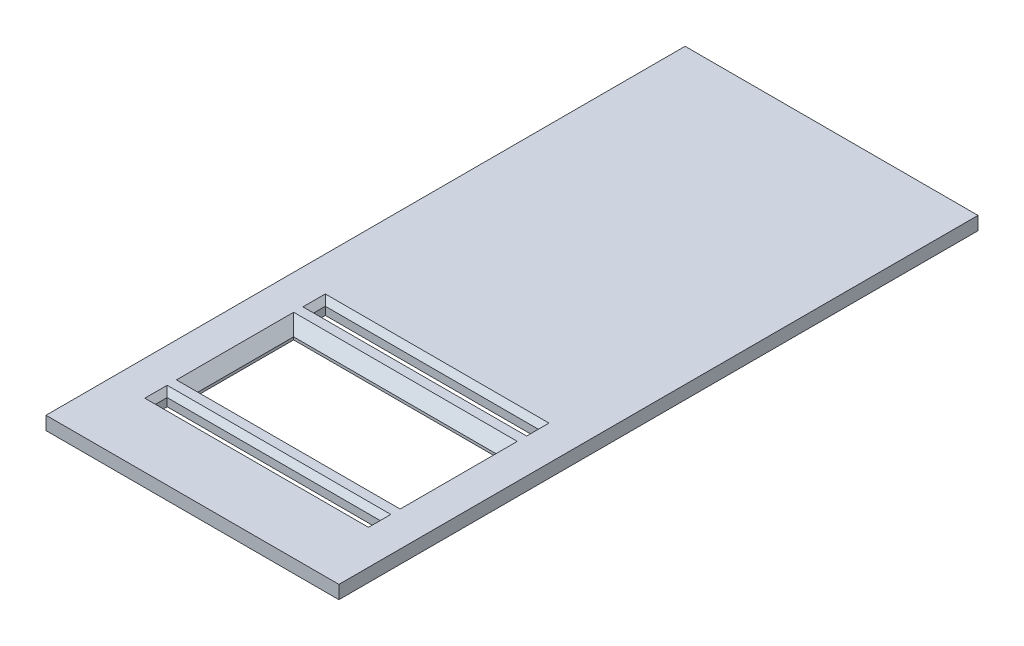
from build123d import *

# Parameters (mm, degrees)
SKETCH1_W           = 139.7
SKETCH1_H           = 304.8
BOSS_EXTRUDE1_DEPTH = 6.35
SKETCH2_W           = 96.52
SKETCH2_H           = 45.72
MAIN_HOLE_DEPTH     = 264.5058728
SKETCH3_W           = 101.6
SKETCH3_H           = 5.588
NEOPIXEL_DEPTH      = 264.5058728
SKETCH5_W           = 134.62
SKETCH5_H           = 299.72
SKETCH5_W_2         = 129.54
SKETCH5_H_2         = 294.64
BOSS_EXTRUDE2_DEPTH = 2.54
CHAMFER1_SIZE       = 2.54
CHAMFER2_SIZE       = 5.08


with BuildPart() as part:
    # Sketch1 → Boss-Extrude1 (new body)
    with BuildSketch(Plane(origin=(0, 0, 0), x_dir=(1, 0, 0), z_dir=(0, 1, 0))):
        with Locations((0, 101.6)):
            Rectangle(SKETCH1_W, SKETCH1_H)
    extrude(amount=BOSS_EXTRUDE1_DEPTH)

    # Sketch2 → Main Hole (cut, through all)
    with BuildSketch(Plane(origin=(0, 6.35, 0), x_dir=(1, 0, 0), z_dir=(0, 1, 0))):
        with Locations((0, 22.86)):
            Rectangle(SKETCH2_W, SKETCH2_H)
    extrude(amount=-MAIN_HOLE_DEPTH, mode=Mode.SUBTRACT)

    # Sketch3 → NeoPixel (cut, through all)
    with BuildSketch(Plane(origin=(0, 6.35, 0), x_dir=(1, 0, 0), z_dir=(0, 1, 0))):
        with Locations((0, 60.579)):
            Rectangle(SKETCH3_W, SKETCH3_H)
    neopixel = extrude(amount=-NEOPIXEL_DEPTH, mode=Mode.SUBTRACT)

    # Mirror2: NeoPixel across plane
    add(neopixel.mirror(Plane.XY.offset(-22.86)), mode=Mode.SUBTRACT)

    # Sketch5 → Boss-Extrude2 (add)
    with BuildSketch(Plane.XZ):
        with Locations((0, -101.6)):
            Rectangle(SKETCH5_W, SKETCH5_H)
        with Locations((0, -101.6)):
            Rectangle(SKETCH5_W_2, SKETCH5_H_2, mode=Mode.SUBTRACT)
    extrude(amount=BOSS_EXTRUDE2_DEPTH)

    # Chamfer1
    chamfer1_edges = [part.edges().sort_by_distance(p)[0] for p in [
        (50.8, 6.35, 14.859),
        (0, 6.35, 17.653),
        (-50.8, 6.35, 14.859),
        (0, 6.35, 12.065),
        (-50.8, 6.35, -60.579),
        (0, 6.35, -57.785),
        (50.8, 6.35, -60.579),
        (0, 6.35, -63.373),
    ]]
    chamfer(chamfer1_edges, length=CHAMFER1_SIZE)

    # Chamfer2
    chamfer2_edges = [part.edges().sort_by_distance(p)[0] for p in [
        (48.26, 6.35, -22.86),
        (0, 6.35, 0),
        (-48.26, 6.35, -22.86),
        (0, 6.35, -45.72),
    ]]
    chamfer(chamfer2_edges, length=CHAMFER2_SIZE)


solid = part.part
